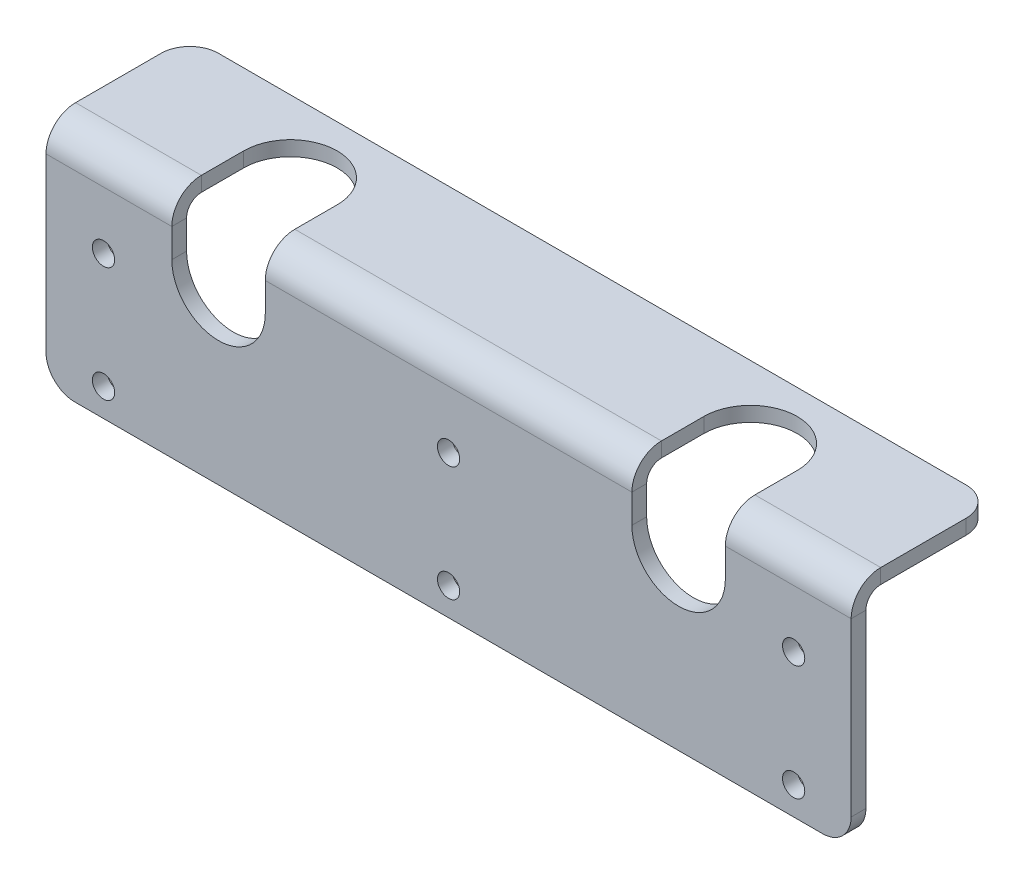
from build123d import *

# Parameters (mm, degrees)
BASE_FLANGE1_DEPTH           = 177.8
CUT_EXTRUDE1_DEPTH           = 6.5278
F_10_0_1935_DIAMETER_HOLE1_D = 4.9149
FILLET1_R                    = 6.35
CUT_EXTRUDE2_DEPTH           = 3.2639


# Sheet-metal steps are written as plain solids
with BuildPart() as part:
    # Sketch1 → Base-Flange1 (new body)
    with BuildSketch(Plane(origin=(0, 0, 0), x_dir=(0, 0, -1), z_dir=(1, 0, 0))):
        with BuildLine():
            Line((31.75, 0), (6.5278, 0))
            ThreePointArc((6.5278, 0), (1.911948354, -1.911948354), (0, -6.5278))
            Line((0, -6.5278), (0, -50.8))
            Line((0, -50.8), (3.2639, -50.8))
            Line((3.2639, -50.8), (3.2639, -6.5278))
            ThreePointArc((3.2639, -6.5278), (4.219874177, -4.219874177), (6.5278, -3.2639))
            Line((6.5278, -3.2639), (31.75, -3.2639))
            Line((31.75, -3.2639), (31.75, 0))
        make_face()
    extrude(amount=BASE_FLANGE1_DEPTH)

    # Sketch6 → Cut-Extrude1 (cut)
    with BuildSketch(Plane(origin=(0, 0, 0), x_dir=(1, 0, 0), z_dir=(0, 1, 0))):
        with BuildLine():
            Line((27.78125, 0), (27.78125, 15.875))
            ThreePointArc((27.78125, 15.875), (38.1, 26.19375), (48.41875, 15.875))
            Line((48.41875, 15.875), (48.41875, 0))
            ThreePointArc((48.41875, 0), (38.1, -10.31875), (27.78125, 0))
        make_face()
        with BuildLine():
            Line((129.38125, 0), (129.38125, 15.875))
            ThreePointArc((129.38125, 15.875), (139.7, 26.19375), (150.01875, 15.875))
            Line((150.01875, 15.875), (150.01875, 0))
            ThreePointArc((150.01875, 0), (139.7, -10.31875), (129.38125, 0))
        make_face()
    extrude(amount=-CUT_EXTRUDE1_DEPTH, mode=Mode.SUBTRACT)

    # #10 (0.1935) Diameter Hole1 (through all)
    with Locations(Plane.XY):
        with Locations((12.7, -19.2278), (88.9, -19.2278), (165.1, -19.2278), (88.9, -44.6278), (165.1, -44.6278), (12.7, -44.6278)):
            Hole(F_10_0_1935_DIAMETER_HOLE1_D / 2)

    # Fillet1
    fillet1_edges = [part.edges().sort_by_distance(p)[0] for p in [
        (177.8, -50.8, -1.63195),
        (0, -50.8, -1.63195),
        (177.8, -1.63195, -31.75),
        (0, -1.63195, -31.75),
    ]]
    fillet(fillet1_edges, radius=FILLET1_R)

    # Sketch9 → Cut-Extrude2 (cut)
    with BuildSketch(Plane.XY):
        with BuildLine():
            Line((48.41875, -6.5278), (48.41875, -12.8778))
            ThreePointArc((48.41875, -12.8778), (38.1, -23.19655), (27.78125, -12.8778))
            Line((27.78125, -12.8778), (27.78125, -6.5278))
            ThreePointArc((27.78125, -6.5278), (38.1, 3.79095), (48.41875, -6.5278))
        make_face()
        with BuildLine():
            Line((150.01875, -6.5278), (150.01875, -12.8778))
            ThreePointArc((150.01875, -12.8778), (139.7, -23.19655), (129.38125, -12.8778))
            Line((129.38125, -12.8778), (129.38125, -6.5278))
            ThreePointArc((129.38125, -6.5278), (139.7, 3.79095), (150.01875, -6.5278))
        make_face()
    extrude(amount=-CUT_EXTRUDE2_DEPTH, mode=Mode.SUBTRACT)


solid = part.part
